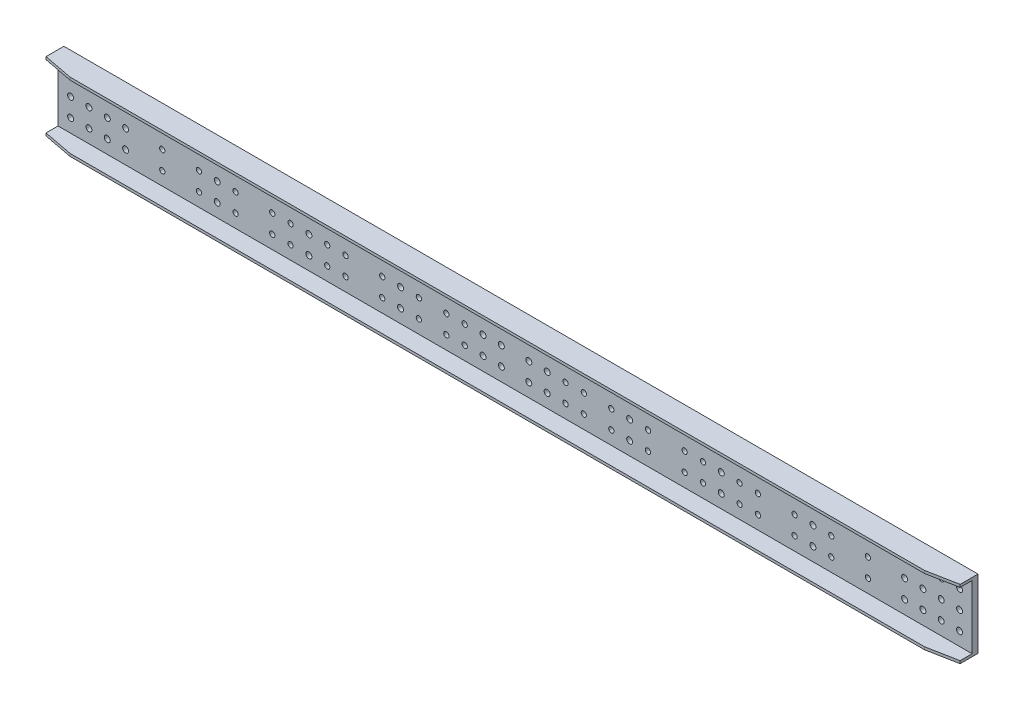
from build123d import *

# Parameters (mm, degrees)
SKETCH_1_W          = 3990
SKETCH_1_H          = 300
SKETCH_1_R          = 13
SKETCH_1_R_2        = 11.5
EXTRUDE_1538_DEPTH  = 25.5
SKETCH_2_W          = 3990
SKETCH_2_H          = 11.5
EXTRUDE_1_DEPTH     = 77.5
SKETCH_3_W          = 70
SKETCH_3_H          = 230
EXTRUDE_2_DEPTH     = 16
SKETCH_4_R          = 13
CUT_EXTRUDE_1_DEPTH = 2003.131676489
CUT_EXTRUDE_2_DEPTH = 2021.057919962


with BuildPart() as part:
    # 草图1 → Extrude 1538 (new body)
    with BuildSketch(Plane.XY):
        Rectangle(SKETCH_1_W, SKETCH_1_H)
        with Locations((1940, 80)):
            Circle(SKETCH_1_R, mode=Mode.SUBTRACT)
        with Locations((1860, 80)):
            Circle(SKETCH_1_R, mode=Mode.SUBTRACT)
        with Locations((1780, 80)):
            Circle(SKETCH_1_R, mode=Mode.SUBTRACT)
        with Locations((1700, 80)):
            Circle(SKETCH_1_R, mode=Mode.SUBTRACT)
        with Locations((1540, 80)):
            Circle(SKETCH_1_R_2, mode=Mode.SUBTRACT)
        with Locations((1380, 80)):
            Circle(SKETCH_1_R_2, mode=Mode.SUBTRACT)
        with Locations((1220, 80)):
            Circle(SKETCH_1_R_2, mode=Mode.SUBTRACT)
        with Locations((1060, 80)):
            Circle(SKETCH_1_R_2, mode=Mode.SUBTRACT)
        with Locations((980, 80)):
            Circle(SKETCH_1_R_2, mode=Mode.SUBTRACT)
        with Locations((820, 80)):
            Circle(SKETCH_1_R_2, mode=Mode.SUBTRACT)
        with Locations((740, 80)):
            Circle(SKETCH_1_R_2, mode=Mode.SUBTRACT)
        with Locations((580, 80)):
            Circle(SKETCH_1_R_2, mode=Mode.SUBTRACT)
        with Locations((980, 0)):
            Circle(SKETCH_1_R_2, mode=Mode.SUBTRACT)
        with Locations((1060, 0)):
            Circle(SKETCH_1_R_2, mode=Mode.SUBTRACT)
        with Locations((820, 0)):
            Circle(SKETCH_1_R_2, mode=Mode.SUBTRACT)
        with Locations((740, 0)):
            Circle(SKETCH_1_R_2, mode=Mode.SUBTRACT)
        with Locations((580, 0)):
            Circle(SKETCH_1_R_2, mode=Mode.SUBTRACT)
        with Locations((1220, 0)):
            Circle(SKETCH_1_R_2, mode=Mode.SUBTRACT)
        with Locations((1380, 0)):
            Circle(SKETCH_1_R_2, mode=Mode.SUBTRACT)
        with Locations((1540, 0)):
            Circle(SKETCH_1_R_2, mode=Mode.SUBTRACT)
        with Locations((1700, 0)):
            Circle(SKETCH_1_R, mode=Mode.SUBTRACT)
        with Locations((1780, 0)):
            Circle(SKETCH_1_R, mode=Mode.SUBTRACT)
        with Locations((1860, 0)):
            Circle(SKETCH_1_R, mode=Mode.SUBTRACT)
        with Locations((1940, 0)):
            Circle(SKETCH_1_R, mode=Mode.SUBTRACT)
        with Locations((420, 80)):
            Circle(SKETCH_1_R_2, mode=Mode.SUBTRACT)
        with Locations((420, 0)):
            Circle(SKETCH_1_R_2, mode=Mode.SUBTRACT)
        with Locations((300, 0)):
            Circle(SKETCH_1_R_2, mode=Mode.SUBTRACT)
        with Locations((300, 80)):
            Circle(SKETCH_1_R_2, mode=Mode.SUBTRACT)
        with Locations((220, 80)):
            Circle(SKETCH_1_R_2, mode=Mode.SUBTRACT)
        with Locations((220, 0)):
            Circle(SKETCH_1_R_2, mode=Mode.SUBTRACT)
        with Locations((140, 0)):
            Circle(SKETCH_1_R, mode=Mode.SUBTRACT)
        with Locations((140, 80)):
            Circle(SKETCH_1_R, mode=Mode.SUBTRACT)
        with Locations((60, 80)):
            Circle(SKETCH_1_R, mode=Mode.SUBTRACT)
        with Locations((60, 0)):
            Circle(SKETCH_1_R, mode=Mode.SUBTRACT)
        with Locations((1700, -80)):
            Circle(SKETCH_1_R, mode=Mode.SUBTRACT)
        with Locations((1780, -80)):
            Circle(SKETCH_1_R, mode=Mode.SUBTRACT)
        with Locations((1860, -80)):
            Circle(SKETCH_1_R, mode=Mode.SUBTRACT)
        with Locations((1940, -80)):
            Circle(SKETCH_1_R, mode=Mode.SUBTRACT)
        with Locations((580, -80)):
            Circle(SKETCH_1_R_2, mode=Mode.SUBTRACT)
        with Locations((740, -80)):
            Circle(SKETCH_1_R_2, mode=Mode.SUBTRACT)
        with Locations((820, -80)):
            Circle(SKETCH_1_R_2, mode=Mode.SUBTRACT)
        with Locations((980, -80)):
            Circle(SKETCH_1_R_2, mode=Mode.SUBTRACT)
        with Locations((1060, -80)):
            Circle(SKETCH_1_R_2, mode=Mode.SUBTRACT)
        with Locations((1220, -80)):
            Circle(SKETCH_1_R_2, mode=Mode.SUBTRACT)
        with Locations((1380, -80)):
            Circle(SKETCH_1_R_2, mode=Mode.SUBTRACT)
        with Locations((1540, -80)):
            Circle(SKETCH_1_R_2, mode=Mode.SUBTRACT)
        with Locations((220, -80)):
            Circle(SKETCH_1_R_2, mode=Mode.SUBTRACT)
        with Locations((300, -80)):
            Circle(SKETCH_1_R_2, mode=Mode.SUBTRACT)
        with Locations((420, -80)):
            Circle(SKETCH_1_R_2, mode=Mode.SUBTRACT)
        with Locations((60, -80)):
            Circle(SKETCH_1_R, mode=Mode.SUBTRACT)
        with Locations((140, -80)):
            Circle(SKETCH_1_R, mode=Mode.SUBTRACT)
        with Locations((-140, -80)):
            Circle(SKETCH_1_R, mode=Mode.SUBTRACT)
        with Locations((-60, -80)):
            Circle(SKETCH_1_R, mode=Mode.SUBTRACT)
        with Locations((-580, -80)):
            Circle(SKETCH_1_R_2, mode=Mode.SUBTRACT)
        with Locations((-420, -80)):
            Circle(SKETCH_1_R_2, mode=Mode.SUBTRACT)
        with Locations((-300, -80)):
            Circle(SKETCH_1_R_2, mode=Mode.SUBTRACT)
        with Locations((-220, -80)):
            Circle(SKETCH_1_R_2, mode=Mode.SUBTRACT)
        with Locations((-1540, -80)):
            Circle(SKETCH_1_R_2, mode=Mode.SUBTRACT)
        with Locations((-1380, -80)):
            Circle(SKETCH_1_R_2, mode=Mode.SUBTRACT)
        with Locations((-1220, -80)):
            Circle(SKETCH_1_R_2, mode=Mode.SUBTRACT)
        with Locations((-1060, -80)):
            Circle(SKETCH_1_R_2, mode=Mode.SUBTRACT)
        with Locations((-980, -80)):
            Circle(SKETCH_1_R_2, mode=Mode.SUBTRACT)
        with Locations((-820, -80)):
            Circle(SKETCH_1_R_2, mode=Mode.SUBTRACT)
        with Locations((-740, -80)):
            Circle(SKETCH_1_R_2, mode=Mode.SUBTRACT)
        with Locations((-1940, -80)):
            Circle(SKETCH_1_R, mode=Mode.SUBTRACT)
        with Locations((-1860, -80)):
            Circle(SKETCH_1_R, mode=Mode.SUBTRACT)
        with Locations((-1780, -80)):
            Circle(SKETCH_1_R, mode=Mode.SUBTRACT)
        with Locations((-1700, -80)):
            Circle(SKETCH_1_R, mode=Mode.SUBTRACT)
        with Locations((-60, 0)):
            Circle(SKETCH_1_R, mode=Mode.SUBTRACT)
        with Locations((-60, 80)):
            Circle(SKETCH_1_R, mode=Mode.SUBTRACT)
        with Locations((-140, 80)):
            Circle(SKETCH_1_R, mode=Mode.SUBTRACT)
        with Locations((-140, 0)):
            Circle(SKETCH_1_R, mode=Mode.SUBTRACT)
        with Locations((-220, 0)):
            Circle(SKETCH_1_R_2, mode=Mode.SUBTRACT)
        with Locations((-220, 80)):
            Circle(SKETCH_1_R_2, mode=Mode.SUBTRACT)
        with Locations((-300, 80)):
            Circle(SKETCH_1_R_2, mode=Mode.SUBTRACT)
        with Locations((-300, 0)):
            Circle(SKETCH_1_R_2, mode=Mode.SUBTRACT)
        with Locations((-420, 0)):
            Circle(SKETCH_1_R_2, mode=Mode.SUBTRACT)
        with Locations((-420, 80)):
            Circle(SKETCH_1_R_2, mode=Mode.SUBTRACT)
        with Locations((-1940, 0)):
            Circle(SKETCH_1_R, mode=Mode.SUBTRACT)
        with Locations((-1860, 0)):
            Circle(SKETCH_1_R, mode=Mode.SUBTRACT)
        with Locations((-1780, 0)):
            Circle(SKETCH_1_R, mode=Mode.SUBTRACT)
        with Locations((-1700, 0)):
            Circle(SKETCH_1_R, mode=Mode.SUBTRACT)
        with Locations((-1540, 0)):
            Circle(SKETCH_1_R_2, mode=Mode.SUBTRACT)
        with Locations((-1380, 0)):
            Circle(SKETCH_1_R_2, mode=Mode.SUBTRACT)
        with Locations((-1220, 0)):
            Circle(SKETCH_1_R_2, mode=Mode.SUBTRACT)
        with Locations((-580, 0)):
            Circle(SKETCH_1_R_2, mode=Mode.SUBTRACT)
        with Locations((-740, 0)):
            Circle(SKETCH_1_R_2, mode=Mode.SUBTRACT)
        with Locations((-820, 0)):
            Circle(SKETCH_1_R_2, mode=Mode.SUBTRACT)
        with Locations((-1060, 0)):
            Circle(SKETCH_1_R_2, mode=Mode.SUBTRACT)
        with Locations((-980, 0)):
            Circle(SKETCH_1_R_2, mode=Mode.SUBTRACT)
        with Locations((-580, 80)):
            Circle(SKETCH_1_R_2, mode=Mode.SUBTRACT)
        with Locations((-740, 80)):
            Circle(SKETCH_1_R_2, mode=Mode.SUBTRACT)
        with Locations((-820, 80)):
            Circle(SKETCH_1_R_2, mode=Mode.SUBTRACT)
        with Locations((-980, 80)):
            Circle(SKETCH_1_R_2, mode=Mode.SUBTRACT)
        with Locations((-1060, 80)):
            Circle(SKETCH_1_R_2, mode=Mode.SUBTRACT)
        with Locations((-1220, 80)):
            Circle(SKETCH_1_R_2, mode=Mode.SUBTRACT)
        with Locations((-1380, 80)):
            Circle(SKETCH_1_R_2, mode=Mode.SUBTRACT)
        with Locations((-1540, 80)):
            Circle(SKETCH_1_R_2, mode=Mode.SUBTRACT)
        with Locations((-1700, 80)):
            Circle(SKETCH_1_R, mode=Mode.SUBTRACT)
        with Locations((-1780, 80)):
            Circle(SKETCH_1_R, mode=Mode.SUBTRACT)
        with Locations((-1860, 80)):
            Circle(SKETCH_1_R, mode=Mode.SUBTRACT)
        with Locations((-1940, 80)):
            Circle(SKETCH_1_R, mode=Mode.SUBTRACT)
    extrude(amount=EXTRUDE_1538_DEPTH)

    # 草图2 → 凸台-拉伸1 (add)
    with BuildSketch(Plane.XY.offset(25.5)):
        with Locations((0, 144.25)):
            Rectangle(SKETCH_2_W, SKETCH_2_H)
        with Locations((0, -144.25)):
            Rectangle(SKETCH_2_W, SKETCH_2_H)
    extrude(amount=EXTRUDE_1_DEPTH)

    # 草图3 → 凸台-拉伸2 (add)
    with BuildSketch(Plane(origin=(0, 0, 0), x_dir=(-1, 0, 0), z_dir=(0, 0, -1))):
        with Locations((1300, 0)):
            Rectangle(SKETCH_3_W, SKETCH_3_H)
        with Locations((900, 0)):
            Rectangle(SKETCH_3_W, SKETCH_3_H)
        with Locations((-1300, 0)):
            Rectangle(SKETCH_3_W, SKETCH_3_H)
        with Locations((500, 0)):
            Rectangle(SKETCH_3_W, SKETCH_3_H)
        with Locations((-900, 0)):
            Rectangle(SKETCH_3_W, SKETCH_3_H)
        with Locations((-500, 0)):
            Rectangle(SKETCH_3_W, SKETCH_3_H)
    extrude(amount=EXTRUDE_2_DEPTH)

    # 草图4 → 切除-拉伸1 (cut, through all)
    with BuildSketch(Plane.XY.offset(25.5)):
        with Locations((1300, 80)):
            Circle(SKETCH_4_R)
        with Locations((900, 80)):
            Circle(SKETCH_4_R)
        with Locations((900, 0)):
            Circle(SKETCH_4_R)
        with Locations((1300, 0)):
            Circle(SKETCH_4_R)
        with Locations((900, -80)):
            Circle(SKETCH_4_R)
        with Locations((1300, -80)):
            Circle(SKETCH_4_R)
        with Locations((500, 80)):
            Circle(SKETCH_4_R)
        with Locations((500, 0)):
            Circle(SKETCH_4_R)
        with Locations((500, -80)):
            Circle(SKETCH_4_R)
        with Locations((-500, -80)):
            Circle(SKETCH_4_R)
        with Locations((-500, 0)):
            Circle(SKETCH_4_R)
        with Locations((-500, 80)):
            Circle(SKETCH_4_R)
        with Locations((-1300, -80)):
            Circle(SKETCH_4_R)
        with Locations((-900, -80)):
            Circle(SKETCH_4_R)
        with Locations((-1300, 0)):
            Circle(SKETCH_4_R)
        with Locations((-900, 0)):
            Circle(SKETCH_4_R)
        with Locations((-900, 80)):
            Circle(SKETCH_4_R)
        with Locations((-1300, 80)):
            Circle(SKETCH_4_R)
    extrude(amount=-CUT_EXTRUDE_1_DEPTH, mode=Mode.SUBTRACT)

    # 草图5 → 切除-拉伸2 (cut, through all)
    with BuildSketch(Plane(origin=(0, 150, 0), x_dir=(-1, 0, 0), z_dir=(0, 1, 0))):
        Polygon((-1995, 78), (-1995, 103), (-1865, 103), align=None)
        Polygon((1865, 103), (1995, 78), (1995, 103), align=None)
    extrude(amount=-CUT_EXTRUDE_2_DEPTH, mode=Mode.SUBTRACT)


solid = part.part
